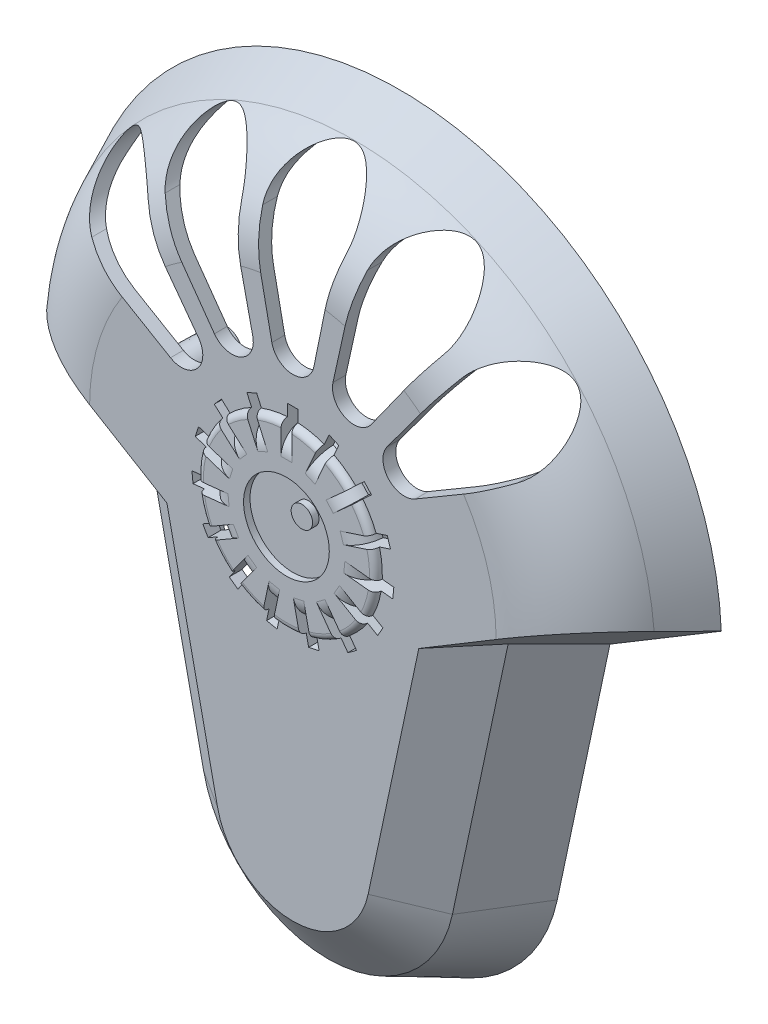
from build123d import *
from OCP.BRepFilletAPI import BRepFilletAPI_MakeChamfer

# Parameters (mm, degrees)
BOSS_EXTRUDE1_DEPTH           = 12.7
BOSS_EXTRUDE1_DRAFT           = 25
FILLET1_R                     = 12.7
CHAMFER1_SIZE                 = 4.5974
CHAMFER1_SIZE2                = 4.007661149
SHELL1_T                      = -1.524
CUT_EXTRUDE1_DEPTH            = 81.557032243
SKETCH3_R                     = 10.6045
BOSS_EXTRUDE2_DEPTH           = 0.762
SKETCH4_W                     = 1.27
SKETCH4_H                     = 2.54
CUT_EXTRUDE2_DEPTH            = 81.680672336
FILLET2_R                     = 2.54
FILLET3_R                     = 0.762
CIRPATTERN3_START             = 12.278888418
CIRPATTERN3_DEPTH             = 1.27
CIRPATTERN3_START_2           = -13.548888418
CIRPATTERN3_2_DEPTH           = 1.27
CIRPATTERN3_START_3           = -24.229848209
CIRPATTERN3_3_DEPTH           = 1.27
CIRPATTERN3_START_4           = -30.831044392
CIRPATTERN3_4_DEPTH           = 1.27
CIRPATTERN3_START_5           = 30.941070178
CIRPATTERN3_5_DEPTH           = 1.27
CIRPATTERN3_START_6           = 26.86130657
CIRPATTERN3_6_DEPTH           = 1.27
CIRPATTERN3_START_7           = 18.02718176
CIRPATTERN3_7_DEPTH           = 1.27
CIRPATTERN3_START_8           = 5.966196183
CIRPATTERN3_8_DEPTH           = 1.27
CIRPATTERN3_START_9           = -7.236196183
CIRPATTERN3_9_DEPTH           = 1.27
CIRPATTERN3_START_10          = -19.29718176
CIRPATTERN3_10_DEPTH          = 1.27
CIRPATTERN3_START_11          = -28.13130657
CIRPATTERN3_11_DEPTH          = 1.27
CIRPATTERN3_START_12          = -32.211070178
CIRPATTERN3_12_DEPTH          = 1.27
CIRPATTERN3_START_13          = 29.561044392
CIRPATTERN3_13_DEPTH          = 1.27
CIRPATTERN3_START_14          = 22.959848209
CIRPATTERN3_14_DEPTH          = 1.27
SKETCH5_R                     = 5.08
SKETCH5_R_2                   = 1.27
CUT_EXTRUDE3_DEPTH            = 0.762
SKETCH6_R                     = 2.2225
BOSS_EXTRUDE3_DEPTH           = 9.525
BOSS_EXTRUDE3_DRAFT           = 1
BOSS_EXTRUDE3_PROFILE_2_DEPTH = 9.525
BOSS_EXTRUDE3_PROFILE_2_DRAFT = 1
BOSS_EXTRUDE3_PROFILE_3_DEPTH = 9.525
BOSS_EXTRUDE3_PROFILE_3_DRAFT = 1
SKETCH8_R                     = 7.62
SKETCH8_R_2                   = 6.35
BOSS_EXTRUDE4_DEPTH           = 3.302


# Read off the part's stored shape, not the designer's step: CirPattern3
# Some blends are built 0.0001 mm under size
with BuildPart() as part:
    # Sketch1 → Boss-Extrude1 (with draft: the straight prism first)
    with BuildSketch(Plane.XY):
        with BuildLine():
            ThreePointArc((-18.633711794, -3.96071771), (0, -19.05), (18.633711794, -3.96071771))
            Line((18.633711794, -3.96071771), (24.874524999, 25.4))
            Line((24.874524999, 25.4), (38.067347186, 33.327047306))
            ThreePointArc((38.067347186, 33.327047306), (0, 69.85), (-38.067347186, 33.327047306))
            Line((-38.067347186, 33.327047306), (-24.874524999, 25.4))
            Line((-24.874524999, 25.4), (-18.633711794, -3.96071771))
        make_face()
    extrude(amount=BOSS_EXTRUDE1_DEPTH)
    # Boss-Extrude1: the draft: its side faces are tilted about the plane it starts from
    boss_extrude1_sides = [part.faces().sort_by_distance(p)[0] for p in [
        (-31.470936092, 29.363523653, 6.35),
        (-21.754118396, 10.719641145, 6.35),
        (0, -19.05, 6.35),
        (21.754118396, 10.719641145, 6.35),
        (31.470936092, 29.363523653, 6.35),
        (0, 69.85, 6.35),
    ]]
    draft(boss_extrude1_sides, Plane.XY, BOSS_EXTRUDE1_DRAFT)

    # Fillet1
    fillet1_edges = [part.edges().sort_by_distance(p)[0] for p in [
        (0, 63.927892741, 12.7),
    ]]
    fillet(fillet1_edges, radius=FILLET1_R)

    # Chamfer1: one chamfer whose edges measure the first distance from different faces: ONE call of the kernel's chamfer builder (chamfer() names one face for all edges)
    chamfer1_edges_1 = [part.edges().sort_by_distance(p)[0] for p in [
        (-16.229110266, 13.210284215, 12.7),
    ]]
    chamfer1_side_1 = [part.faces().sort_by_distance(p)[0] for p in [
        (-18.953741494, 11.982035545, 6.437055985),
    ]]
    chamfer1_edges_2 = [part.edges().sort_by_distance(p)[0] for p in [
        (0, -13.127892741, 12.7),
    ]]
    chamfer1_side_2 = [part.faces().sort_by_distance(p)[0] for p in [
        (0, -16.088946371, 6.35),
    ]]
    chamfer1_edges_3 = [part.edges().sort_by_distance(p)[0] for p in [
        (16.229110266, 13.210284215, 12.7),
    ]]
    chamfer1_side_3 = [part.faces().sort_by_distance(p)[0] for p in [
        (18.953741494, 11.982035545, 6.437055985),
    ]]
    chamfer1 = BRepFilletAPI_MakeChamfer(part.part.solid().wrapped)
    for e in chamfer1_edges_1:
        chamfer1.Add(CHAMFER1_SIZE, CHAMFER1_SIZE2, e.wrapped, chamfer1_side_1[0].wrapped)  # the first distance lies on this face
    for e in chamfer1_edges_2:
        chamfer1.Add(CHAMFER1_SIZE, CHAMFER1_SIZE2, e.wrapped, chamfer1_side_2[0].wrapped)  # the first distance lies on this face
    for e in chamfer1_edges_3:
        chamfer1.Add(CHAMFER1_SIZE, CHAMFER1_SIZE2, e.wrapped, chamfer1_side_3[0].wrapped)  # the first distance lies on this face
    add(Compound.cast(chamfer1.Shape()), mode=Mode.REPLACE)

    # Shell1
    shell1_openings = [part.faces().sort_by_distance(p)[0] for p in [
        (0, 29.936594846, 0),
    ]]
    offset(amount=SHELL1_T, openings=shell1_openings, kind=Kind.INTERSECTION)

    # Sketch2 → Cut-Extrude1 (cut, through all)
    with BuildSketch(Plane.XY.offset(12.7)):
        with BuildLine():
            Line((-2.488681579, 49.022), (-4.977363157, 61.214))
            ThreePointArc((-4.977363157, 61.214), (0, 67.31), (4.977363157, 61.214))
            Line((4.977363157, 61.214), (2.488681579, 49.022))
            ThreePointArc((2.488681579, 49.022), (0, 46.99), (-2.488681579, 49.022))
        make_face()
        with BuildLine():
            Line((4.751010002, 48.541127249), (7.436419403, 60.691311459))
            ThreePointArc((7.436419403, 60.691311459), (14.462933482, 64.235808587), (16.53051441, 56.642359496))
            Line((16.53051441, 56.642359496), (9.298057506, 46.516651267))
            ThreePointArc((9.298057506, 46.516651267), (6.198044895, 45.672564888), (4.751010002, 48.541127249))
        make_face()
        with BuildLine():
            Line((11.169208792, 45.157180281), (18.564377491, 55.164671471))
            ThreePointArc((18.564377491, 55.164671471), (26.425094374, 55.544789973), (25.225389546, 47.766868121))
            Line((25.225389546, 47.766868121), (14.49971482, 41.458278606))
            ThreePointArc((14.49971482, 41.458278606), (11.324391521, 41.948056051), (11.169208792, 45.157180281))
        make_face()
    cut_extrude1 = extrude(amount=-CUT_EXTRUDE1_DEPTH, mode=Mode.SUBTRACT)

    # Mirror1: Cut-Extrude1 across plane
    add(cut_extrude1.mirror(Plane(origin=(0, 0, 0), x_dir=(0, 0, 1), z_dir=(1, 0, 0))), mode=Mode.SUBTRACT)

    # Sketch3 → Boss-Extrude2 (add)
    with BuildSketch(Plane.XY.offset(12.7)):
        with Locations(Location((0, 31.75, 0), (0, 0, 180))):
            Circle(SKETCH3_R)
    extrude(amount=BOSS_EXTRUDE2_DEPTH)

    # Sketch4 → Cut-Extrude2 (cut, through all)
    with BuildSketch(Plane.XY.offset(13.462)):
        with Locations((0, 42.4434)):
            Rectangle(SKETCH4_W, SKETCH4_H)
    extrude(amount=-CUT_EXTRUDE2_DEPTH, mode=Mode.SUBTRACT)

    # Fillet2
    # the kernel refuses this fillet: 2.54 mm, written as the material it takes off along each edge
    with BuildSketch(Plane(origin=(-0.635, 41.1734, 13.462), x_dir=(0, 0, -1), z_dir=(1, 0, 0))) as fillet2_piece_1:
        with BuildLine():
            CenterArc((2.54, -2.52726809), FILLET2_R, 95.739170477, 84.260829523)
            Line((0, -2.52726809), (-0.0508, -2.52726809))
            Line((-0.0508, -2.52726809), (-0.0508, 0))
            Line((-0.0508, 0), (0, 0.0508))
            ThreePointArc((0, 0.0508), (1.143, 0.0508), (2.28092, 0.050545362))
            Line((2.28092, 0.050545362), (2.286, 0))
        make_face()
    extrude(amount=1.27, mode=Mode.SUBTRACT)

    # Fillet3
    fillet3_edges = [part.edges().sort_by_distance(p)[0] for p in [
        (0, 21.1455, 13.462),
    ]]
    fillet(fillet3_edges, radius=FILLET3_R - 0.0001)  # a hair under: the kernel refuses the full size

    # CirPattern3 outline → CirPattern3 (cut)
    with BuildSketch(Plane(origin=(0, 0, 0), x_dir=(-0.4067366430758008, 0.9135454576426006, 0), z_dir=(0.9135454576426006, 0.4067366430758008, 0)).offset(CIRPATTERN3_START)):
        with BuildLine():
            Line((40.96846828, 10), (40.96846828, 13.462))
            Line((40.96846828, 13.462), (35.90120019, 13.462))
            ThreePointArc((35.90120019, 13.462), (37.605083989, 12.805714416), (38.42846828, 11.176))
            Line((38.42846828, 11.176), (38.546660727, 10))
            Line((38.546660727, 10), (40.96846828, 10))
        make_face()
    extrude(amount=CIRPATTERN3_DEPTH, mode=Mode.SUBTRACT)

    # CirPattern3 2 outline → CirPattern3 2 (cut)
    with BuildSketch(Plane(origin=(0, 0, 0), x_dir=(0.40673664307578905, 0.9135454576426059, 0), z_dir=(0.913545457642606, -0.406736643075789, 0)).offset(CIRPATTERN3_START_2)):
        with BuildLine():
            Line((40.96846828, 10), (40.96846828, 13.462))
            Line((40.96846828, 13.462), (35.90120019, 13.462))
            ThreePointArc((35.90120019, 13.462), (37.605083989, 12.805714416), (38.42846828, 11.176))
            Line((38.42846828, 11.176), (38.546660727, 10))
            Line((38.546660727, 10), (40.96846828, 10))
        make_face()
    extrude(amount=CIRPATTERN3_2_DEPTH, mode=Mode.SUBTRACT)

    # CirPattern3 3 outline → CirPattern3 3 (cut)
    with BuildSketch(Plane(origin=(0, 0, 0), x_dir=(0.743144825477386, 0.6691306063588673, 0), z_dir=(0.6691306063588672, -0.7431448254773863, 0)).offset(CIRPATTERN3_START_3)):
        with BuildLine():
            Line((33.208296752, 10), (33.208296752, 13.462))
            Line((33.208296752, 13.462), (28.141028662, 13.462))
            ThreePointArc((28.141028662, 13.462), (29.844912461, 12.805714415), (30.668296752, 11.176))
            Line((30.668296752, 11.176), (30.786489199, 10))
            Line((30.786489199, 10), (33.208296752, 10))
        make_face()
    extrude(amount=CIRPATTERN3_3_DEPTH, mode=Mode.SUBTRACT)

    # CirPattern3 4 outline → CirPattern3 4 (cut)
    with BuildSketch(Plane(origin=(0, 0, 0), x_dir=(0.9510565162951504, 0.3090169943749572, 0), z_dir=(0.30901699437495717, -0.9510565162951505, 0)).offset(CIRPATTERN3_START_4)):
        with BuildLine():
            Line((21.774689571, 10), (21.774689571, 13.462))
            Line((21.774689571, 13.462), (16.707421481, 13.462))
            ThreePointArc((16.707421481, 13.462), (18.41130528, 12.805714416), (19.234689571, 11.176))
            Line((19.234689571, 11.176), (19.352882018, 10))
            Line((19.352882018, 10), (21.774689571, 10))
        make_face()
    extrude(amount=CIRPATTERN3_4_DEPTH, mode=Mode.SUBTRACT)

    # CirPattern3 5 outline → CirPattern3 5 (cut)
    with BuildSketch(Plane(origin=(0, 0, 0), x_dir=(0.9945218953682743, -0.10452846326764395, 0), z_dir=(0.10452846326764395, 0.9945218953682744, 0)).offset(CIRPATTERN3_START_5)):
        with BuildLine():
            Line((8.644621291, -13.462), (8.644621291, -10))
            Line((8.644621291, -10), (6.222813738, -10))
            Line((6.222813738, -10), (6.104621291, -11.176))
            ThreePointArc((6.104621291, -11.176), (5.281237, -12.805714416), (3.577353201, -13.462))
            Line((3.577353201, -13.462), (8.644621291, -13.462))
        make_face()
    extrude(amount=CIRPATTERN3_5_DEPTH, mode=Mode.SUBTRACT)

    # CirPattern3 6 outline → CirPattern3 6 (cut)
    with BuildSketch(Plane(origin=(0, 0, 0), x_dir=(0.8660254037844431, -0.4999999999999921, 0), z_dir=(0.4999999999999921, 0.8660254037844433, 0)).offset(CIRPATTERN3_START_6)):
        with BuildLine():
            Line((-3.9116, -13.462), (-3.9116, -10))
            Line((-3.9116, -10), (-6.333407553, -10))
            Line((-6.333407553, -10), (-6.4516, -11.176))
            ThreePointArc((-6.4516, -11.176), (-7.274984291, -12.805714416), (-8.97886809, -13.462))
            Line((-8.97886809, -13.462), (-3.9116, -13.462))
        make_face()
    extrude(amount=CIRPATTERN3_6_DEPTH, mode=Mode.SUBTRACT)

    # CirPattern3 7 outline → CirPattern3 7 (cut)
    with BuildSketch(Plane(origin=(0, 0, 0), x_dir=(0.5877852522924796, -0.8090169943749428, 0), z_dir=(0.8090169943749427, 0.5877852522924798, 0)).offset(CIRPATTERN3_START_7)):
        with BuildLine():
            Line((-13.722889571, -13.462), (-13.722889571, -10))
            Line((-13.722889571, -10), (-16.144697124, -10))
            Line((-16.144697124, -10), (-16.262889571, -11.176))
            ThreePointArc((-16.262889571, -11.176), (-17.086273863, -12.805714416), (-18.790157662, -13.462))
            Line((-18.790157662, -13.462), (-13.722889571, -13.462))
        make_face()
    extrude(amount=CIRPATTERN3_7_DEPTH, mode=Mode.SUBTRACT)

    # CirPattern3 8 outline → CirPattern3 8 (cut)
    with BuildSketch(Plane(origin=(0, 0, 0), x_dir=(-0.20791169081776606, 0.9781476007338042, 0), z_dir=(0.9781476007338042, 0.20791169081776606, 0)).offset(CIRPATTERN3_START_8)):
        with BuildLine():
            Line((19.092786323, 13.462), (19.092786323, 10))
            Line((19.092786323, 10), (21.514593876, 10))
            Line((21.514593876, 10), (21.632786323, 11.176))
            ThreePointArc((21.632786323, 11.176), (22.456170615, 12.805714416), (24.160054414, 13.462))
            Line((24.160054414, 13.462), (19.092786323, 13.462))
        make_face()
    extrude(amount=CIRPATTERN3_8_DEPTH, mode=Mode.SUBTRACT)

    # CirPattern3 9 outline → CirPattern3 9 (cut)
    with BuildSketch(Plane(origin=(0, 0, 0), x_dir=(0.20791169081775301, 0.978147600733807, 0), z_dir=(0.978147600733807, -0.207911690817753, 0)).offset(CIRPATTERN3_START_9)):
        with BuildLine():
            Line((19.092786323, 13.462), (19.092786323, 10))
            Line((19.092786323, 10), (21.514593876, 10))
            Line((21.514593876, 10), (21.632786323, 11.176))
            ThreePointArc((21.632786323, 11.176), (22.456170615, 12.805714416), (24.160054414, 13.462))
            Line((24.160054414, 13.462), (19.092786323, 13.462))
        make_face()
    extrude(amount=CIRPATTERN3_9_DEPTH, mode=Mode.SUBTRACT)

    # CirPattern3 10 outline → CirPattern3 10 (cut)
    with BuildSketch(Plane(origin=(0, 0, 0), x_dir=(0.5877852522924693, 0.8090169943749502, 0), z_dir=(0.8090169943749502, -0.5877852522924693, 0)).offset(CIRPATTERN3_START_10)):
        with BuildLine():
            Line((13.722889571, 13.462), (13.722889571, 10))
            Line((13.722889571, 10), (16.144697124, 10))
            Line((16.144697124, 10), (16.262889571, 11.176))
            ThreePointArc((16.262889571, 11.176), (17.086273863, 12.805714416), (18.790157662, 13.462))
            Line((18.790157662, 13.462), (13.722889571, 13.462))
        make_face()
    extrude(amount=CIRPATTERN3_10_DEPTH, mode=Mode.SUBTRACT)

    # CirPattern3 11 outline → CirPattern3 11 (cut)
    with BuildSketch(Plane(origin=(0, 0, 0), x_dir=(0.8660254037844362, 0.5000000000000042, 0), z_dir=(0.5000000000000042, -0.8660254037844363, 0)).offset(CIRPATTERN3_START_11)):
        with BuildLine():
            Line((3.9116, 13.462), (3.9116, 10))
            Line((3.9116, 10), (6.333407553, 10))
            Line((6.333407553, 10), (6.4516, 11.176))
            ThreePointArc((6.4516, 11.176), (7.274984291, 12.805714416), (8.97886809, 13.462))
            Line((8.97886809, 13.462), (3.9116, 13.462))
        make_face()
    extrude(amount=CIRPATTERN3_11_DEPTH, mode=Mode.SUBTRACT)

    # CirPattern3 12 outline → CirPattern3 12 (cut)
    with BuildSketch(Plane(origin=(0, 0, 0), x_dir=(0.994521895368273, 0.104528463267657, 0), z_dir=(0.104528463267657, -0.994521895368273, 0)).offset(CIRPATTERN3_START_12)):
        with BuildLine():
            Line((-8.644621291, 13.462), (-8.644621291, 10))
            Line((-8.644621291, 10), (-6.222813738, 10))
            Line((-6.222813738, 10), (-6.104621291, 11.176))
            ThreePointArc((-6.104621291, 11.176), (-5.281237, 12.805714416), (-3.577353201, 13.462))
            Line((-3.577353201, 13.462), (-8.644621291, 13.462))
        make_face()
    extrude(amount=CIRPATTERN3_12_DEPTH, mode=Mode.SUBTRACT)

    # CirPattern3 13 outline → CirPattern3 13 (cut)
    with BuildSketch(Plane(origin=(0, 0, 0), x_dir=(0.9510565162951542, -0.30901699437494523, 0), z_dir=(0.3090169943749452, 0.9510565162951544, 0)).offset(CIRPATTERN3_START_13)):
        with BuildLine():
            Line((-21.774689571, -10), (-21.774689571, -13.462))
            Line((-21.774689571, -13.462), (-16.707421481, -13.462))
            ThreePointArc((-16.707421481, -13.462), (-18.41130528, -12.805714416), (-19.234689571, -11.176))
            Line((-19.234689571, -11.176), (-19.352882018, -10))
            Line((-19.352882018, -10), (-21.774689571, -10))
        make_face()
    extrude(amount=CIRPATTERN3_13_DEPTH, mode=Mode.SUBTRACT)

    # CirPattern3 14 outline → CirPattern3 14 (cut)
    with BuildSketch(Plane(origin=(0, 0, 0), x_dir=(0.743144825477395, -0.6691306063588573, 0), z_dir=(0.6691306063588572, 0.7431448254773952, 0)).offset(CIRPATTERN3_START_14)):
        with BuildLine():
            Line((-33.208296752, -10), (-33.208296752, -13.462))
            Line((-33.208296752, -13.462), (-28.141028662, -13.462))
            ThreePointArc((-28.141028662, -13.462), (-29.844912461, -12.805714415), (-30.668296752, -11.176))
            Line((-30.668296752, -11.176), (-30.786489199, -10))
            Line((-30.786489199, -10), (-33.208296752, -10))
        make_face()
    extrude(amount=CIRPATTERN3_14_DEPTH, mode=Mode.SUBTRACT)

    # Sketch5 → Cut-Extrude3 (cut)
    with BuildSketch(Plane.XY.offset(13.462)):
        with Locations((0, 31.75)):
            Circle(SKETCH5_R)
        with Locations((1.828009106, 33.691327018)):
            Circle(SKETCH5_R_2, mode=Mode.SUBTRACT)
    extrude(amount=-CUT_EXTRUDE3_DEPTH, mode=Mode.SUBTRACT)


with BuildPart() as boss_extrude3_tool:
    # Sketch6 → Boss-Extrude3 (with draft: the straight prism first)
    with BuildSketch(Plane(origin=(0, 0, 11.176), x_dir=(-1, 0, 0), z_dir=(0, 0, -1))):
        Circle(SKETCH6_R)
    extrude(amount=BOSS_EXTRUDE3_DEPTH)
    # Boss-Extrude3: the draft: its side faces are tilted about the plane it starts from
    boss_extrude3_sides = [boss_extrude3_tool.faces().sort_by_distance(p)[0] for p in [
        (2.2225, 0, 6.4135),
    ]]
    draft(boss_extrude3_sides, Plane(origin=(0, 0, 11.176), x_dir=(-1, 0, 0), z_dir=(0, 0, -1)), BOSS_EXTRUDE3_DRAFT)


with BuildPart() as part_1:
    add(part.part)

    # Boss-Extrude3: add boss_extrude3_tool
    add(boss_extrude3_tool.part)


with BuildPart() as boss_extrude3_profile_2_tool:
    # Sketch6 → Boss-Extrude3 profile 2 (with draft: the straight prism first)
    with BuildSketch(Plane(origin=(0, 0, 11.176), x_dir=(-1, 0, 0), z_dir=(0, 0, -1))):
        with Locations((-19.05, 34.925)):
            Circle(SKETCH6_R)
    extrude(amount=BOSS_EXTRUDE3_PROFILE_2_DEPTH)
    # Boss-Extrude3 profile 2: the draft: its side faces are tilted about the plane it starts from
    boss_extrude3_profile_2_sides = [boss_extrude3_profile_2_tool.faces().sort_by_distance(p)[0] for p in [
        (21.2725, 34.925, 6.4135),
    ]]
    draft(boss_extrude3_profile_2_sides, Plane(origin=(0, 0, 11.176), x_dir=(-1, 0, 0), z_dir=(0, 0, -1)), BOSS_EXTRUDE3_PROFILE_2_DRAFT)


with BuildPart() as part_2:
    add(part_1.part)

    # Boss-Extrude3 profile 2: add boss_extrude3_profile_2_tool
    add(boss_extrude3_profile_2_tool.part)


with BuildPart() as boss_extrude3_profile_3_tool:
    # Sketch6 → Boss-Extrude3 profile 3 (with draft: the straight prism first)
    with BuildSketch(Plane(origin=(0, 0, 11.176), x_dir=(-1, 0, 0), z_dir=(0, 0, -1))):
        with Locations((19.05, 34.925)):
            Circle(SKETCH6_R)
    extrude(amount=BOSS_EXTRUDE3_PROFILE_3_DEPTH)
    # Boss-Extrude3 profile 3: the draft: its side faces are tilted about the plane it starts from
    boss_extrude3_profile_3_sides = [boss_extrude3_profile_3_tool.faces().sort_by_distance(p)[0] for p in [
        (-16.8275, 34.925, 6.4135),
    ]]
    draft(boss_extrude3_profile_3_sides, Plane(origin=(0, 0, 11.176), x_dir=(-1, 0, 0), z_dir=(0, 0, -1)), BOSS_EXTRUDE3_PROFILE_3_DRAFT)


with BuildPart() as part_3:
    add(part_2.part)

    # Boss-Extrude3 profile 3: add boss_extrude3_profile_3_tool
    add(boss_extrude3_profile_3_tool.part)

    # Cut-Extrude4 cone 1 section (through the dimple's axis) → Cut-Extrude4 (revolve, cut)
    with BuildSketch(Plane(origin=(19.05, 34.925, 11.176), x_dir=(0, -1, 0), z_dir=(1, 0, 0))):
        Polygon((0, 0), (1.27, 0), (0, 72.758251271), align=None)
    revolve(axis=Axis((19.05, 34.925, 11.176), (0, 0, -1)), mode=Mode.SUBTRACT)

    # Cut-Extrude4 cone 2 section (through the dimple's axis) → Cut-Extrude4 cone 2 (revolve, cut)
    with BuildSketch(Plane(origin=(-19.05, 34.925, 11.176), x_dir=(0, -1, 0), z_dir=(1, 0, 0))):
        Polygon((0, 0), (1.27, 0), (0, 72.758251271), align=None)
    revolve(axis=Axis((-19.05, 34.925, 11.176), (0, 0, -1)), mode=Mode.SUBTRACT)

    # Cut-Extrude4 cone 3 section (through the dimple's axis) → Cut-Extrude4 cone 3 (revolve, cut)
    with BuildSketch(Plane(origin=(0, 0, 11.176), x_dir=(0, -1, 0), z_dir=(1, 0, 0))):
        Polygon((0, 0), (1.27, 0), (0, 72.758251271), align=None)
    revolve(axis=Axis((0, 0, 11.176), (0, 0, -1)), mode=Mode.SUBTRACT)

    # Sketch8 → Boss-Extrude4 (add)
    with BuildSketch(Plane(origin=(0, 0, 11.176), x_dir=(-1, 0, 0), z_dir=(0, 0, -1))):
        with Locations(Location((0, 31.75, 0), (0, 0, 180))):
            Circle(SKETCH8_R)
        with Locations(Location((0, 31.75, 0), (0, 0, 180))):
            Circle(SKETCH8_R_2, mode=Mode.SUBTRACT)
    extrude(amount=BOSS_EXTRUDE4_DEPTH)


solid = part_3.part
